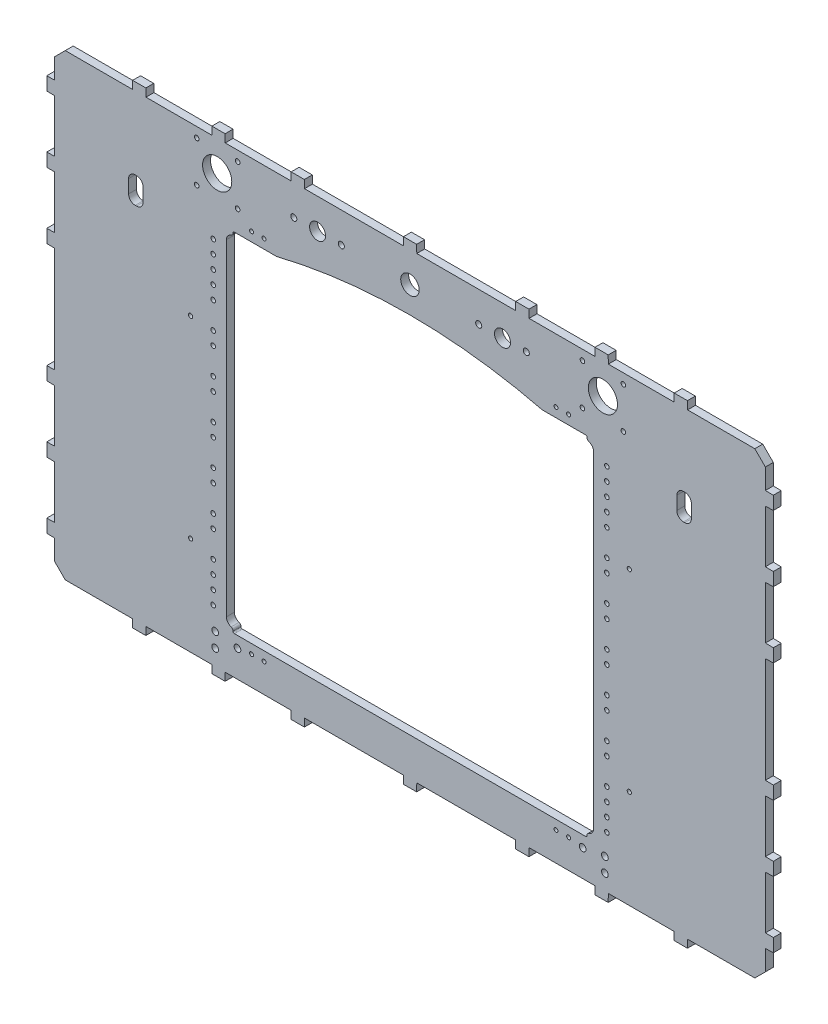
from build123d import *

# Parameters (mm, degrees)
SKETCH_1_R      = 1.6
SKETCH_1_R_2    = 1.5
SKETCH_1_R_3    = 2.55
SKETCH_1_R_4    = 1.75
SKETCH_1_R_5    = 11.05
SKETCH_1_R_6    = 2.3
SKETCH_1_R_7    = 6.05
SKETCH_1_R_8    = 7
EXTRUDE_1_DEPTH = 6


with BuildPart() as part:
    # Эскиз1 → Бобышка-Вытянуть1 (new body)
    with BuildSketch(Plane.XY):
        Polygon((1843.680450761, 414.691345467), (1893.480450761, 414.691345467), (1893.580450761, 408.691345469), (1903.580450761, 408.691345469), (1903.680450761, 414.691345467), (1954.58045076, 414.691345467), (1962.58045076, 422.691345467), (1962.58045076, 438.091345466), (1968.580450759, 438.191345467), (1968.580450759, 448.191345467), (1962.580450761, 448.291345467), (1962.580450761, 488.091345466), (1968.580450759, 488.191345467), (1968.580450759, 498.191345467), (1962.580450761, 498.291345467), (1962.580450761, 538.091345466), (1968.580450759, 538.191345467), (1968.580450759, 548.191345467), (1962.580450761, 548.291345467), (1962.580450761, 628.091345466), (1968.580450759, 628.191345467), (1968.580450759, 638.191345467), (1962.580450761, 638.291345467), (1962.580450761, 678.091345466), (1968.580450759, 678.191345467), (1968.580450759, 688.191345467), (1962.580450761, 688.291345467), (1962.580450761, 728.091345466), (1968.580450759, 728.191345467), (1968.580450759, 738.191345467), (1962.580450761, 738.291345469), (1962.580450761, 753.691345469), (1954.580450761, 761.691345469), (1903.680450761, 761.691345469), (1903.58045076, 767.691345468), (1893.58045076, 767.691345468), (1893.48045076, 761.691345469), (1854.58045076, 761.691345469), (1843.680450761, 761.691345469), (1843.58045076, 767.691345468), (1833.58045076, 767.691345468), (1833.48045076, 761.691345469), (1783.680450761, 761.691345469), (1783.58045076, 767.691345468), (1773.58045076, 767.691345468), (1773.48045076, 761.691345469), (1698.680450762, 761.691345469), (1698.580450761, 767.691345468), (1688.580450761, 767.691345468), (1688.480450761, 761.691345469), (1613.680450761, 761.691345469), (1613.58045076, 767.691345468), (1603.58045076, 767.691345468), (1603.48045076, 761.691345469), (1553.680450761, 761.691345469), (1553.58045076, 767.691345468), (1543.58045076, 767.691345468), (1543.48045076, 761.691345469), (1532.58045076, 761.691345469), (1493.680450761, 761.691345469), (1493.58045076, 767.691345468), (1483.58045076, 767.691345468), (1483.48045076, 761.691345469), (1432.580450761, 761.691345469), (1424.580450761, 753.691345469), (1424.580450761, 738.291345469), (1418.580450762, 738.191345469), (1418.580450762, 728.191345469), (1424.580450761, 728.091345469), (1424.580450761, 688.291345469), (1418.580450762, 688.191345469), (1418.580450762, 678.191345469), (1424.580450761, 678.091345469), (1424.580450761, 638.291345469), (1418.580450762, 638.191345469), (1418.580450762, 628.191345469), (1424.580450761, 628.091345469), (1424.580450761, 548.291345469), (1418.580450762, 548.191345469), (1418.580450762, 538.191345469), (1424.580450761, 538.091345468), (1424.580450761, 498.291345469), (1418.580450762, 498.191345469), (1418.580450762, 488.191345469), (1424.58045076, 488.091345468), (1424.58045076, 448.291345469), (1418.580450762, 448.191345469), (1418.580450762, 438.191345469), (1424.58045076, 438.091345468), (1424.58045076, 422.691345469), (1432.58045076, 414.691345469), (1483.48045076, 414.691345469), (1483.580450761, 408.69134547), (1493.580450761, 408.69134547), (1493.680450761, 414.691345469), (1532.58045076, 414.691345469), (1543.48045076, 414.691345469), (1543.580450761, 408.69134547), (1553.580450761, 408.69134547), (1553.680450761, 414.691345469), (1603.48045076, 414.691345469), (1603.580450761, 408.69134547), (1613.580450761, 408.69134547), (1613.680450761, 414.691345468), (1688.480450761, 414.691345468), (1688.580450761, 408.691345469), (1698.580450761, 408.691345469), (1698.680450761, 414.691345468), (1773.480450761, 414.691345468), (1773.580450761, 408.691345469), (1783.580450761, 408.691345469), (1783.680450761, 414.691345467), (1833.480450761, 414.691345467), (1833.580450761, 408.691345469), (1843.580450761, 408.691345469), align=None)
        with Locations((1859.58045076, 489.241345467)):
            Circle(SKETCH_1_R, mode=Mode.SUBTRACT)
        with Locations((1859.58045076, 635.241345467)):
            Circle(SKETCH_1_R, mode=Mode.SUBTRACT)
        with Locations((1527.472555367, 489.241345467)):
            Circle(SKETCH_1_R, mode=Mode.SUBTRACT)
        with Locations((1527.472555367, 635.241345467)):
            Circle(SKETCH_1_R, mode=Mode.SUBTRACT)
        with Locations((1804.08045076, 436.470646701)):
            Circle(SKETCH_1_R_2, mode=Mode.SUBTRACT)
        with Locations((1813.58045076, 436.470646701)):
            Circle(SKETCH_1_R_2, mode=Mode.SUBTRACT)
        with Locations((1824.227659727, 434.980879116)):
            Circle(SKETCH_1_R_3, mode=Mode.SUBTRACT)
        with Locations((1841.08045076, 426.691345469)):
            Circle(SKETCH_1_R_3, mode=Mode.SUBTRACT)
        with Locations((1841.08045076, 437.691345469)):
            Circle(SKETCH_1_R_3, mode=Mode.SUBTRACT)
        with Locations((1842.58045076, 454.191345469)):
            Circle(SKETCH_1_R_4, mode=Mode.SUBTRACT)
        with Locations((1842.58045076, 464.191345469)):
            Circle(SKETCH_1_R_4, mode=Mode.SUBTRACT)
        with Locations((1842.58045076, 474.191345469)):
            Circle(SKETCH_1_R_4, mode=Mode.SUBTRACT)
        with Locations((1842.58045076, 484.191345469)):
            Circle(SKETCH_1_R_4, mode=Mode.SUBTRACT)
        with Locations((1842.58045076, 504.191345469)):
            Circle(SKETCH_1_R_4, mode=Mode.SUBTRACT)
        with Locations((1842.58045076, 514.191345469)):
            Circle(SKETCH_1_R_4, mode=Mode.SUBTRACT)
        with Locations((1842.58045076, 534.191345469)):
            Circle(SKETCH_1_R_4, mode=Mode.SUBTRACT)
        with Locations((1842.58045076, 544.191345469)):
            Circle(SKETCH_1_R_4, mode=Mode.SUBTRACT)
        with Locations((1842.58045076, 564.191345469)):
            Circle(SKETCH_1_R_4, mode=Mode.SUBTRACT)
        with Locations((1842.58045076, 574.191345469)):
            Circle(SKETCH_1_R_4, mode=Mode.SUBTRACT)
        with Locations((1842.58045076, 594.191345469)):
            Circle(SKETCH_1_R_4, mode=Mode.SUBTRACT)
        with Locations((1842.58045076, 604.191345469)):
            Circle(SKETCH_1_R_4, mode=Mode.SUBTRACT)
        with Locations((1842.58045076, 624.191345469)):
            Circle(SKETCH_1_R_4, mode=Mode.SUBTRACT)
        with Locations((1842.58045076, 634.191345469)):
            Circle(SKETCH_1_R_4, mode=Mode.SUBTRACT)
        with Locations((1842.58045076, 654.191345469)):
            Circle(SKETCH_1_R_4, mode=Mode.SUBTRACT)
        with Locations((1842.58045076, 664.191345469)):
            Circle(SKETCH_1_R_4, mode=Mode.SUBTRACT)
        with Locations((1842.58045076, 674.191345469)):
            Circle(SKETCH_1_R_4, mode=Mode.SUBTRACT)
        with Locations((1842.58045076, 684.191345469)):
            Circle(SKETCH_1_R_4, mode=Mode.SUBTRACT)
        with Locations((1842.58045076, 694.191345469)):
            Circle(SKETCH_1_R_4, mode=Mode.SUBTRACT)
        with Locations((1583.08045076, 436.470646701)):
            Circle(SKETCH_1_R_2, mode=Mode.SUBTRACT)
        with Locations((1573.58045076, 436.470646701)):
            Circle(SKETCH_1_R_2, mode=Mode.SUBTRACT)
        with Locations((1562.93045076, 434.980879116)):
            Circle(SKETCH_1_R_3, mode=Mode.SUBTRACT)
        with Locations((1546.08045076, 426.691345469)):
            Circle(SKETCH_1_R_3, mode=Mode.SUBTRACT)
        with Locations((1546.08045076, 437.691345469)):
            Circle(SKETCH_1_R_3, mode=Mode.SUBTRACT)
        with Locations((1544.58045076, 454.191345688)):
            Circle(SKETCH_1_R_4, mode=Mode.SUBTRACT)
        with Locations((1544.58045076, 464.191345688)):
            Circle(SKETCH_1_R_4, mode=Mode.SUBTRACT)
        with Locations((1544.58045076, 474.191345688)):
            Circle(SKETCH_1_R_4, mode=Mode.SUBTRACT)
        with Locations((1544.58045076, 484.191345688)):
            Circle(SKETCH_1_R_4, mode=Mode.SUBTRACT)
        with Locations((1544.58045076, 504.191345688)):
            Circle(SKETCH_1_R_4, mode=Mode.SUBTRACT)
        with Locations((1544.58045076, 514.191345688)):
            Circle(SKETCH_1_R_4, mode=Mode.SUBTRACT)
        with Locations((1544.58045076, 534.191345688)):
            Circle(SKETCH_1_R_4, mode=Mode.SUBTRACT)
        with Locations((1544.58045076, 544.191345688)):
            Circle(SKETCH_1_R_4, mode=Mode.SUBTRACT)
        with Locations((1544.58045076, 564.191345688)):
            Circle(SKETCH_1_R_4, mode=Mode.SUBTRACT)
        with Locations((1544.58045076, 574.191345688)):
            Circle(SKETCH_1_R_4, mode=Mode.SUBTRACT)
        with Locations((1544.58045076, 594.191345688)):
            Circle(SKETCH_1_R_4, mode=Mode.SUBTRACT)
        with Locations((1544.58045076, 604.191345688)):
            Circle(SKETCH_1_R_4, mode=Mode.SUBTRACT)
        with Locations((1544.58045076, 624.191345688)):
            Circle(SKETCH_1_R_4, mode=Mode.SUBTRACT)
        with Locations((1544.58045076, 634.191345688)):
            Circle(SKETCH_1_R_4, mode=Mode.SUBTRACT)
        with Locations((1544.58045076, 654.191345688)):
            Circle(SKETCH_1_R_4, mode=Mode.SUBTRACT)
        with Locations((1544.58045076, 664.191345688)):
            Circle(SKETCH_1_R_4, mode=Mode.SUBTRACT)
        with Locations((1544.58045076, 674.191345688)):
            Circle(SKETCH_1_R_4, mode=Mode.SUBTRACT)
        with Locations((1544.58045076, 684.191345688)):
            Circle(SKETCH_1_R_4, mode=Mode.SUBTRACT)
        with Locations((1544.58045076, 694.191345688)):
            Circle(SKETCH_1_R_4, mode=Mode.SUBTRACT)
        with Locations((1804.08045076, 713.691345469)):
            Circle(SKETCH_1_R_2, mode=Mode.SUBTRACT)
        with Locations((1813.58045076, 713.691345469)):
            Circle(SKETCH_1_R_2, mode=Mode.SUBTRACT)
        with Locations((1824.08045076, 723.191345469)):
            Circle(SKETCH_1_R_4, mode=Mode.SUBTRACT)
        with Locations((1855.08045076, 723.191345469)):
            Circle(SKETCH_1_R_4, mode=Mode.SUBTRACT)
        with Locations((1839.58045076, 738.691345469)):
            Circle(SKETCH_1_R_5, mode=Mode.SUBTRACT)
        with Locations((1855.08045076, 754.191345469)):
            Circle(SKETCH_1_R_4, mode=Mode.SUBTRACT)
        with Locations((1824.08045076, 754.191345469)):
            Circle(SKETCH_1_R_4, mode=Mode.SUBTRACT)
        with Locations((1781.58045076, 738.691345469)):
            Circle(SKETCH_1_R_6, mode=Mode.SUBTRACT)
        with Locations((1763.58045076, 738.691345469)):
            Circle(SKETCH_1_R_7, mode=Mode.SUBTRACT)
        with Locations((1745.58045076, 738.691345469)):
            Circle(SKETCH_1_R_6, mode=Mode.SUBTRACT)
        with Locations((1693.526503064, 738.691345469)):
            Circle(SKETCH_1_R_8, mode=Mode.SUBTRACT)
        with Locations((1641.58045076, 738.691345469)):
            Circle(SKETCH_1_R_6, mode=Mode.SUBTRACT)
        with Locations((1623.58045076, 738.691345469)):
            Circle(SKETCH_1_R_7, mode=Mode.SUBTRACT)
        with Locations((1605.58045076, 738.691345469)):
            Circle(SKETCH_1_R_6, mode=Mode.SUBTRACT)
        with Locations((1583.08045076, 713.691345469)):
            Circle(SKETCH_1_R_2, mode=Mode.SUBTRACT)
        with Locations((1573.58045076, 713.691345469)):
            Circle(SKETCH_1_R_2, mode=Mode.SUBTRACT)
        with Locations((1563.08045076, 723.191345469)):
            Circle(SKETCH_1_R_4, mode=Mode.SUBTRACT)
        with Locations((1563.08045076, 754.191345469)):
            Circle(SKETCH_1_R_4, mode=Mode.SUBTRACT)
        with Locations((1547.58045076, 738.691345469)):
            Circle(SKETCH_1_R_5, mode=Mode.SUBTRACT)
        with Locations((1532.08045076, 723.191345469)):
            Circle(SKETCH_1_R_4, mode=Mode.SUBTRACT)
        with Locations((1532.08045076, 754.191345469)):
            Circle(SKETCH_1_R_4, mode=Mode.SUBTRACT)
        with BuildLine():
            Line((1554.58045076, 451.470646701), (1554.58045076, 698.691345469))
            ThreePointArc((1554.58045076, 698.691345469), (1555.571532132, 701.679416993), (1558.151879332, 703.482919707))
            ThreePointArc((1558.151879332, 703.482919707), (1559.184018212, 704.204320793), (1559.58045076, 705.399549402))
            Line((1559.58045076, 705.399549402), (1559.58045076, 705.691345469))
            ThreePointArc((1559.58045076, 705.691345469), (1559.873343979, 706.398452251), (1560.58045076, 706.691345469))
            Line((1560.58045076, 706.691345469), (1592.563784093, 706.691345469))
            ThreePointArc((1592.563784093, 706.691345469), (1693.122117427, 718.84112619), (1793.680450761, 706.691345469))
            Line((1793.680450761, 706.691345469), (1826.580467982, 706.691345469))
            ThreePointArc((1826.580467982, 706.691345469), (1827.287574764, 706.398452251), (1827.580467982, 705.691345469))
            Line((1827.580467982, 705.691345469), (1827.580467982, 705.399549402))
            ThreePointArc((1827.580467982, 705.399549402), (1827.976900531, 704.204320793), (1829.009039411, 703.482919707))
            ThreePointArc((1829.009039411, 703.482919707), (1831.589391061, 701.679411023), (1832.580467982, 698.691330578))
            Line((1832.580467982, 698.691330578), (1832.579713792, 451.470631809))
            ThreePointArc((1832.579713792, 451.470631809), (1831.588627971, 448.482569208), (1829.008285221, 446.679072463))
            ThreePointArc((1829.008285221, 446.679072463), (1827.976146341, 445.957671378), (1827.579713792, 444.762442768))
            Line((1827.579713792, 444.762442768), (1827.579713792, 444.470646701))
            ThreePointArc((1827.579713792, 444.470646701), (1827.286820574, 443.76353992), (1826.579713792, 443.470646701))
            Line((1826.579713792, 443.470646701), (1560.58045076, 443.470646701))
            ThreePointArc((1560.58045076, 443.470646701), (1559.873343979, 443.763539919), (1559.58045076, 444.470646701))
            Line((1559.58045076, 444.470646701), (1559.58045076, 444.762442768))
            ThreePointArc((1559.58045076, 444.762442768), (1559.184018212, 445.957671377), (1558.151879332, 446.679072463))
            ThreePointArc((1558.151879332, 446.679072463), (1555.571532132, 448.482575177), (1554.58045076, 451.470646701))
        make_face(mode=Mode.SUBTRACT)
        with BuildLine():
            Line((1486.512534834, 686.691345469), (1485.512534834, 686.691345469))
            ThreePointArc((1485.512534834, 686.691345469), (1481.977000928, 688.155811563), (1480.512534834, 691.691345469))
            Line((1480.512534834, 691.691345469), (1480.512534834, 701.691345469))
            ThreePointArc((1480.512534834, 701.691345469), (1481.977000928, 705.226879375), (1485.512534834, 706.691345469))
            Line((1485.512534834, 706.691345469), (1486.512534834, 706.691345469))
            ThreePointArc((1486.512534834, 706.691345469), (1490.04806874, 705.226879375), (1491.512534834, 701.691345469))
            Line((1491.512534834, 701.691345469), (1491.512534834, 691.691345469))
            ThreePointArc((1491.512534834, 691.691345469), (1490.04806874, 688.155811563), (1486.512534834, 686.691345469))
        make_face(mode=Mode.SUBTRACT)
        with BuildLine():
            Line((1900.540471293, 706.691345469), (1901.540471293, 706.691345469))
            ThreePointArc((1901.540471293, 706.691345469), (1905.076005199, 705.226879375), (1906.540471293, 701.691345469))
            Line((1906.540471293, 701.691345469), (1906.540471293, 691.691345469))
            ThreePointArc((1906.540471293, 691.691345469), (1905.076005199, 688.155811563), (1901.540471293, 686.691345469))
            Line((1901.540471293, 686.691345469), (1900.540471293, 686.691345469))
            ThreePointArc((1900.540471293, 686.691345469), (1897.004937387, 688.155811563), (1895.540471293, 691.691345469))
            Line((1895.540471293, 691.691345469), (1895.540471293, 701.691345469))
            ThreePointArc((1895.540471293, 701.691345469), (1897.004937387, 705.226879375), (1900.540471293, 706.691345469))
        make_face(mode=Mode.SUBTRACT)
    extrude(amount=EXTRUDE_1_DEPTH)


solid = part.part
